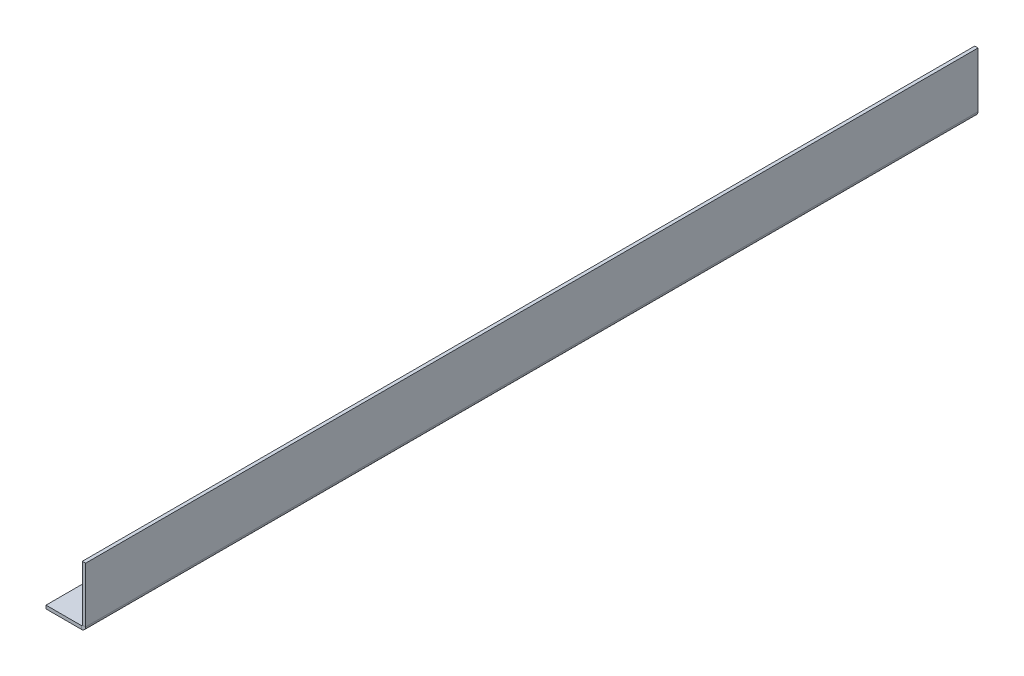
from build123d import *

# Parameters (mm, degrees)
SKETCH1_W                    = 675
SKETCH1_H                    = 45
BASE_FLANGE1_DEPTH           = 2.5
EDGE_FLANGE1_STRIP_W         = 11.4732
EDGE_FLANGE1_STRIP_H         = 2.5
EDGE_FLANGE1_STRIP_CUT_DEPTH = 675
EDGE_FLANGE1_DEPTH           = 675
SKETCH9_R                    = 5
CUT_EXTRUDE1_DEPTH           = 10
LPATTERN1_COUNT              = 4
LPATTERN1_PITCH              = 200


# Sheet-metal steps are written as plain solids
with BuildPart() as part:
    # Sketch1 → Base-Flange1 (new body)
    with BuildSketch(Plane(origin=(0, 0, 0), x_dir=(0, 0, -1), z_dir=(1, 0, 0))):
        with Locations((337.5, 22.5)):
            Rectangle(SKETCH1_W, SKETCH1_H)
    extrude(amount=-BASE_FLANGE1_DEPTH)

    # Edge-Flange1 strip (across the edge) → Edge-Flange1 strip cut (cut)
    with BuildSketch(Plane(origin=(-2.5, 0, -675), x_dir=(0, 1, 0), z_dir=(0, 0, 1))):
        with Locations((-2.5, -1.25)):
            Rectangle(EDGE_FLANGE1_STRIP_W, EDGE_FLANGE1_STRIP_H)
    extrude(amount=EDGE_FLANGE1_STRIP_CUT_DEPTH, mode=Mode.SUBTRACT)

    # Edge-Flange1 section (across the edge) → Edge-Flange1 (add)
    with BuildSketch(Plane(origin=(-2.5, 0, -675), x_dir=(0, 1, 0), z_dir=(0, 0, 1))):
        with BuildLine():
            Line((0, 0.7366), (0, 27.5))
            Line((0, 27.5), (2.5, 27.5))
            Line((2.5, 27.5), (2.5, 0.7366))
            ThreePointArc((2.5, 0.7366), (2.715745145, 0.215745145), (3.2366, 0))
            Line((3.2366, 0), (3.2366, -2.5))
            ThreePointArc((3.2366, -2.5), (0.947978192, -1.552021808), (0, 0.7366))
        make_face()
    extrude(amount=EDGE_FLANGE1_DEPTH)

    # Sketch9 → Cut-Extrude1 (cut)
    with BuildSketch(Plane(origin=(0, 0, 0), x_dir=(-1, 0, 0), z_dir=(0, -1, 0))):
        with Locations(Location((15, 637.5, 0), (0, 0, 180))):
            Circle(SKETCH9_R)
    cut_extrude1 = extrude(amount=-CUT_EXTRUDE1_DEPTH, mode=Mode.SUBTRACT)

    # LPattern1: Cut-Extrude1 ×4
    with Locations(*[(0, 0, i * LPATTERN1_PITCH) for i in range(1, LPATTERN1_COUNT)]):
        add(cut_extrude1, mode=Mode.SUBTRACT)


solid = part.part
